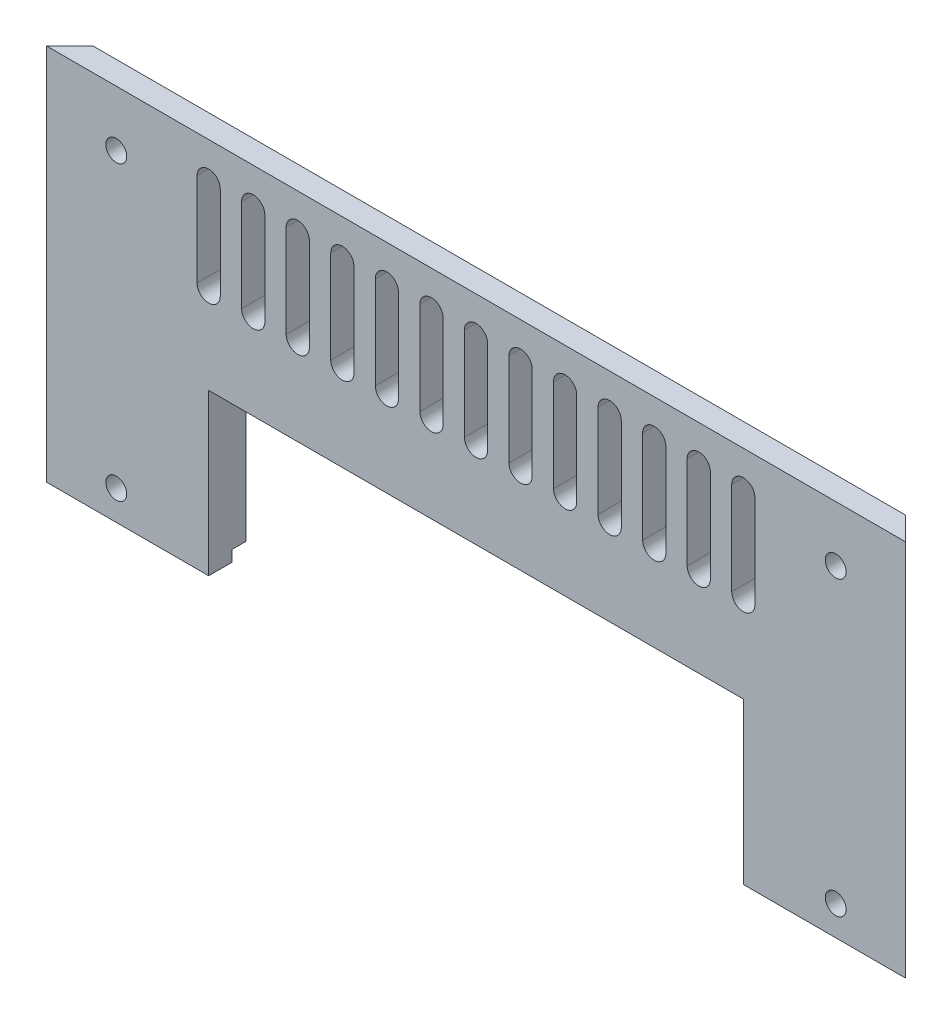
from build123d import *

# Parameters (mm, degrees)
SKETCH1_W           = 185
SKETCH1_H           = 84
SKETCH1_R           = 2.25
BOSS_EXTRUDE1_DEPTH = 5
SKETCH2_W           = 185
SKETCH2_H           = 79
SKETCH2_R           = 2.25
BOSS_EXTRUDE2_DEPTH = 3
CHAMFER1_SIZE       = 8
CHAMFER3_SIZE       = 3
SKETCH3_W           = 7.071067812
SKETCH3_H           = 2.6
CUT_EXTRUDE1_DEPTH  = 221.270985121
SKETCH4_W           = 115.2
SKETCH4_H           = 34.6
CUT_EXTRUDE2_DEPTH  = 204.334699449


with BuildPart() as part:
    # Sketch1 → Boss-Extrude1 (new body)
    with BuildSketch(Plane.XY):
        with Locations((92.5, 42)):
            Rectangle(SKETCH1_W, SKETCH1_H)
        with Locations((15, 9)):
            Circle(SKETCH1_R, mode=Mode.SUBTRACT)
        with Locations(Location((170, 9, 0), (0, 0, 180))):
            Circle(SKETCH1_R, mode=Mode.SUBTRACT)
        with Locations((15, 72)):
            Circle(SKETCH1_R, mode=Mode.SUBTRACT)
        with Locations(Location((170, 72, 0), (0, 0, 180))):
            Circle(SKETCH1_R, mode=Mode.SUBTRACT)
    extrude(amount=-BOSS_EXTRUDE1_DEPTH)

    # Sketch2 → Boss-Extrude2 (add)
    with BuildSketch(Plane(origin=(0, 0, -5), x_dir=(-1, 0, 0), z_dir=(0, 0, -1))):
        with Locations((-92.5, 44.5)):
            Rectangle(SKETCH2_W, SKETCH2_H)
        with Locations(Location((-15, 9, 0), (0, 0, 180))):
            Circle(SKETCH2_R, mode=Mode.SUBTRACT)
        with Locations((-170, 9)):
            Circle(SKETCH2_R, mode=Mode.SUBTRACT)
        with Locations(Location((-15, 72, 0), (0, 0, 180))):
            Circle(SKETCH2_R, mode=Mode.SUBTRACT)
        with Locations((-170, 72)):
            Circle(SKETCH2_R, mode=Mode.SUBTRACT)
    extrude(amount=BOSS_EXTRUDE2_DEPTH)

    # Chamfer1
    # the kernel refuses this chamfer: 8 mm, written as the material it takes off along each edge
    with BuildSketch(Plane(origin=(185, -15.573463904, -8), x_dir=(-0.9996219169112968, 0, -0.027495876610586296), z_dir=(0, 1, 0)), Plane(origin=(0, 104.573463904, -8), x_dir=(0.9996219169112968, 0, -0.027495876610586275), z_dir=(0, -1, 0))) as chamfer1_piece_1:
        Polygon((CHAMFER1_SIZE * 0.999621916911, CHAMFER1_SIZE * 0.0274958766106), (-CHAMFER1_SIZE * 0.0274958766106, CHAMFER1_SIZE * 0.999621916911), (0, 0), align=None)
    extrude(amount=120.146927807, mode=Mode.SUBTRACT)

    # Chamfer3
    chamfer3_edges = [part.edges().sort_by_distance(p)[0] for p in [
        (92.5, 84, -8),
    ]]
    chamfer(chamfer3_edges, length=CHAMFER3_SIZE)

    # Sketch3 → Cut-Extrude1 (cut, through all, along a direction that is not the sketch's normal)
    with BuildSketch(Plane(origin=(92.5, 0, -92.5), x_dir=(-0.7071067811865452, 0, -0.7071067811865498), z_dir=(0.7071067811865498, 0, -0.7071067811865452))):
        with Locations((-127.279220614, 1.3)):
            Rectangle(SKETCH3_W, SKETCH3_H)
    extrude(amount=-CUT_EXTRUDE1_DEPTH, dir=(1, 0, 0), mode=Mode.SUBTRACT)

    # Sketch4 → Cut-Extrude2 (cut, through all)
    with BuildSketch(Plane.XY):
        with Locations((92.5, 19.9)):
            Rectangle(SKETCH4_W, SKETCH4_H)
        with BuildLine():
            Line((37.4, 76), (37.4, 56))
            ThreePointArc((37.4, 56), (34.9, 53.5), (32.4, 56))
            Line((32.4, 56), (32.4, 76))
            ThreePointArc((32.4, 76), (34.9, 78.5), (37.4, 76))
        make_face()
        with BuildLine():
            Line((47, 76), (47, 56))
            ThreePointArc((47, 56), (44.5, 53.5), (42, 56))
            Line((42, 56), (42, 76))
            ThreePointArc((42, 76), (44.5, 78.5), (47, 76))
        make_face()
        with BuildLine():
            Line((56.6, 76), (56.6, 56))
            ThreePointArc((56.6, 56), (54.1, 53.5), (51.6, 56))
            Line((51.6, 56), (51.6, 76))
            ThreePointArc((51.6, 76), (54.1, 78.5), (56.6, 76))
        make_face()
        with BuildLine():
            Line((66.2, 76), (66.2, 56))
            ThreePointArc((66.2, 56), (63.7, 53.5), (61.2, 56))
            Line((61.2, 56), (61.2, 76))
            ThreePointArc((61.2, 76), (63.7, 78.5), (66.2, 76))
        make_face()
        with BuildLine():
            Line((75.8, 76), (75.8, 56))
            ThreePointArc((75.8, 56), (73.3, 53.5), (70.8, 56))
            Line((70.8, 56), (70.8, 76))
            ThreePointArc((70.8, 76), (73.3, 78.5), (75.8, 76))
        make_face()
        with BuildLine():
            Line((85.4, 76), (85.4, 56))
            ThreePointArc((85.4, 56), (82.9, 53.5), (80.4, 56))
            Line((80.4, 56), (80.4, 76))
            ThreePointArc((80.4, 76), (82.9, 78.5), (85.4, 76))
        make_face()
        with BuildLine():
            Line((95, 76), (95, 56))
            ThreePointArc((95, 56), (92.5, 53.5), (90, 56))
            Line((90, 56), (90, 76))
            ThreePointArc((90, 76), (92.5, 78.5), (95, 76))
        make_face()
        with BuildLine():
            Line((104.6, 76), (104.6, 56))
            ThreePointArc((104.6, 56), (102.1, 53.5), (99.6, 56))
            Line((99.6, 56), (99.6, 76))
            ThreePointArc((99.6, 76), (102.1, 78.5), (104.6, 76))
        make_face()
        with BuildLine():
            Line((114.2, 76), (114.2, 56))
            ThreePointArc((114.2, 56), (111.7, 53.5), (109.2, 56))
            Line((109.2, 56), (109.2, 76))
            ThreePointArc((109.2, 76), (111.7, 78.5), (114.2, 76))
        make_face()
        with BuildLine():
            Line((123.8, 76), (123.8, 56))
            ThreePointArc((123.8, 56), (121.3, 53.5), (118.8, 56))
            Line((118.8, 56), (118.8, 76))
            ThreePointArc((118.8, 76), (121.3, 78.5), (123.8, 76))
        make_face()
        with BuildLine():
            Line((133.4, 76), (133.4, 56))
            ThreePointArc((133.4, 56), (130.9, 53.5), (128.4, 56))
            Line((128.4, 56), (128.4, 76))
            ThreePointArc((128.4, 76), (130.9, 78.5), (133.4, 76))
        make_face()
        with BuildLine():
            Line((143, 76), (143, 56))
            ThreePointArc((143, 56), (140.5, 53.5), (138, 56))
            Line((138, 56), (138, 76))
            ThreePointArc((138, 76), (140.5, 78.5), (143, 76))
        make_face()
        with BuildLine():
            Line((152.6, 76), (152.6, 56))
            ThreePointArc((152.6, 56), (150.1, 53.5), (147.6, 56))
            Line((147.6, 56), (147.6, 76))
            ThreePointArc((147.6, 76), (150.1, 78.5), (152.6, 76))
        make_face()
    extrude(amount=-CUT_EXTRUDE2_DEPTH, mode=Mode.SUBTRACT)


solid = part.part
